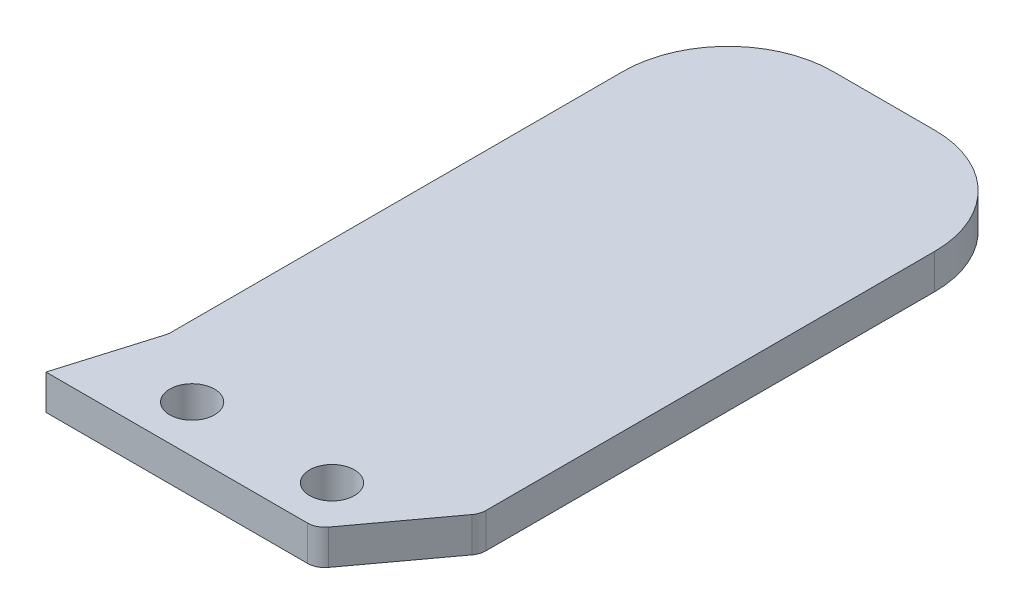
from build123d import *

# Parameters (mm, degrees)
SKETCH1_R           = 2.032
BOSS_EXTRUDE1_DEPTH = 3.175
FILLET1_R           = 9.525
FILLET2_R           = 1.5875


with BuildPart() as part:
    # Sketch1 → Boss-Extrude1 (new body)
    with BuildSketch(Plane(origin=(0, 0, 0), x_dir=(1, 0, 0), z_dir=(0, 1, 0))):
        Polygon((0, 0), (2.556997935, 8.560515758), (2.556997935, 59.360515758), (30.853495644, 59.360515758), (30.853495644, 8.560515758), (24.542700319, 0), align=None)
        with Locations((8.985200319, 4.280257879)):
            Circle(SKETCH1_R, mode=Mode.SUBTRACT)
        with Locations((21.685200319, 4.280257879)):
            Circle(SKETCH1_R, mode=Mode.SUBTRACT)
    extrude(amount=BOSS_EXTRUDE1_DEPTH)

    # Fillet1
    fillet1_edges = [part.edges().sort_by_distance(p)[0] for p in [
        (2.556997935, 1.5875, -59.360515758),
        (30.853495644, 1.5875, -59.360515758),
    ]]
    fillet(fillet1_edges, radius=FILLET1_R)

    # Fillet2
    fillet2_edges = [part.edges().sort_by_distance(p)[0] for p in [
        (2.556997935, 1.5875, -8.560515758),
        (30.853495644, 1.5875, -8.560515758),
        (24.542700319, 1.5875, 0),
    ]]
    fillet(fillet2_edges, radius=FILLET2_R)


solid = part.part
